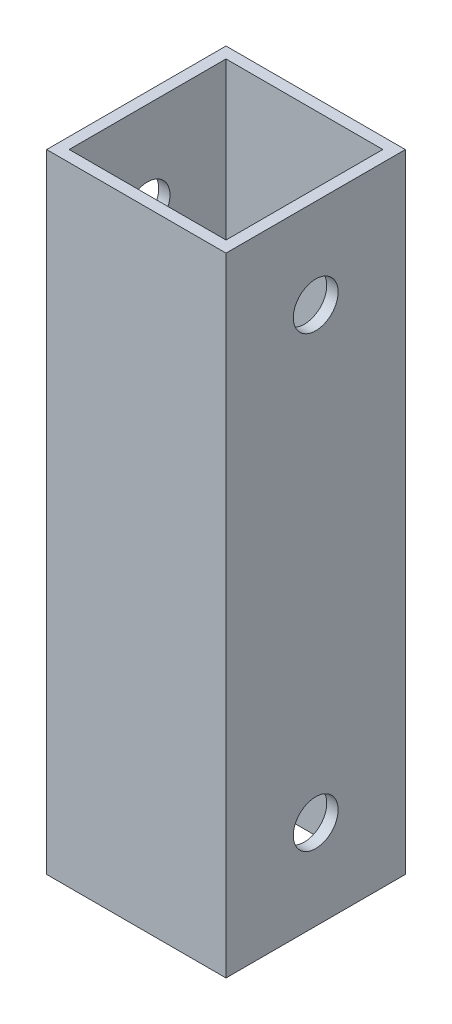
from build123d import *

# Parameters (mm, degrees)
SKETCH1_W           = 50.8
SKETCH1_H           = 50.8
SKETCH1_W_2         = 44.416753927
SKETCH1_H_2         = 44.416753927
BOSS_EXTRUDE1_DEPTH = 177.8
SKETCH2_R           = 6.35
CUT_EXTRUDE1_DEPTH  = 187.6511184


with BuildPart() as part:
    # Sketch1 → Boss-Extrude1 (new body)
    with BuildSketch(Plane(origin=(0, 0, 0), x_dir=(1, 0, 0), z_dir=(0, 1, 0))):
        Rectangle(SKETCH1_W, SKETCH1_H)
        with Locations((-0.016623037, 0.016623037)):
            Rectangle(SKETCH1_W_2, SKETCH1_H_2, mode=Mode.SUBTRACT)
    extrude(amount=BOSS_EXTRUDE1_DEPTH)

    # Sketch2 → Cut-Extrude1 (cut, through all)
    with BuildSketch(Plane.ZY.offset(25.4)):
        with Locations((0, 25.4)):
            Circle(SKETCH2_R)
        with Locations((0, 152.4)):
            Circle(SKETCH2_R)
    extrude(amount=-CUT_EXTRUDE1_DEPTH, mode=Mode.SUBTRACT)


solid = part.part
